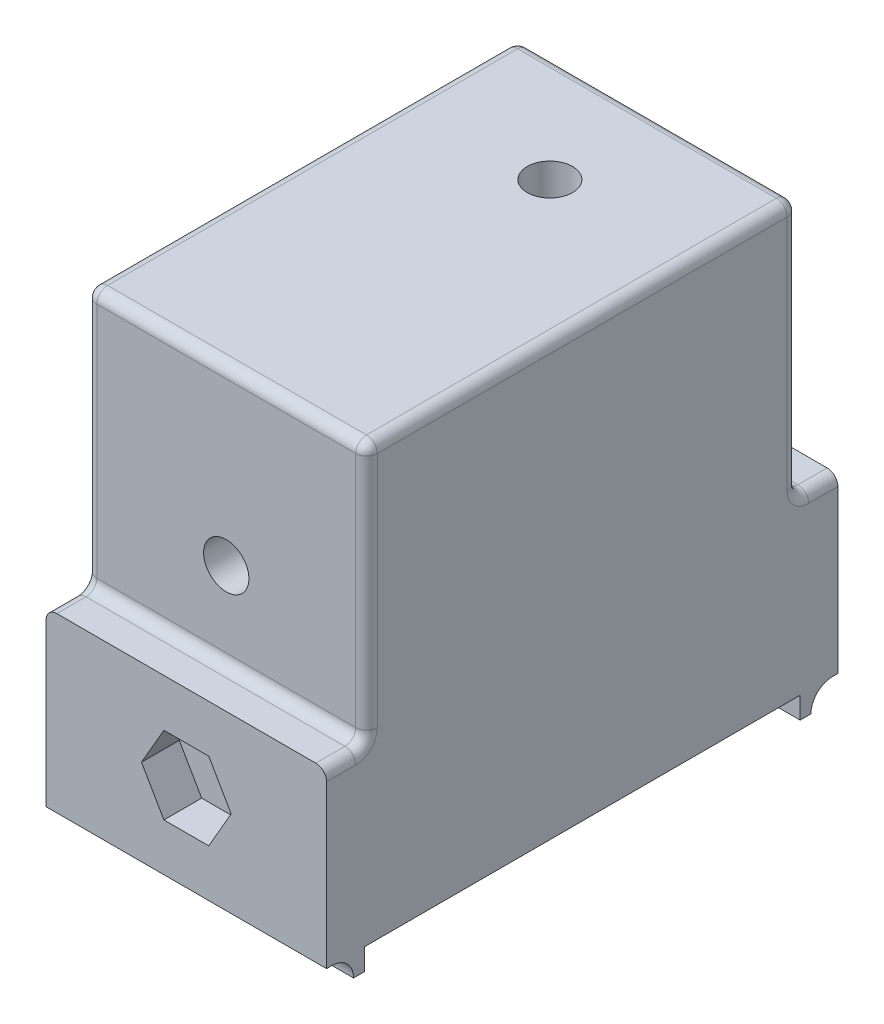
from build123d import *

# Parameters (mm, degrees)
SKETCH1_W           = 26
SKETCH1_H           = 40
BOSS_EXTRUDE1_DEPTH = 40
SKETCH2_W           = 26
SKETCH2_H           = 3.7
BOSS_EXTRUDE2_DEPTH = 16
SKETCH5_W           = 20
SKETCH5_H           = 34
CUT_EXTRUDE3_DEPTH  = 37
FILLET1_R           = 1
FILLET2_R           = 1
CUT_EXTRUDE6_DEPTH  = 3.5
SKETCH9_W           = 26
SKETCH9_H           = 1
BOSS_EXTRUDE3_DEPTH = 2
CUT_EXTRUDE7_REACH  = 62.652
SKETCH12_R          = 2.1
CUT_EXTRUDE8_REACH  = 51.947
SKETCH13_R          = 2.1
FILLET3_R           = 2


with BuildPart() as part:
    # Sketch1 → Boss-Extrude1 (new body)
    with BuildSketch(Plane(origin=(0, 0, 0), x_dir=(1, 0, 0), z_dir=(0, 1, 0))):
        Rectangle(SKETCH1_W, SKETCH1_H)
    extrude(amount=BOSS_EXTRUDE1_DEPTH)

    # Sketch2 → Boss-Extrude2 (add)
    with BuildSketch(Plane.XZ):
        with Locations((0, 21.85)):
            Rectangle(SKETCH2_W, SKETCH2_H)
        with Locations((0, -21.85)):
            Rectangle(SKETCH2_W, SKETCH2_H)
    extrude(amount=-BOSS_EXTRUDE2_DEPTH)

    # Sketch5 → Cut-Extrude3 (cut)
    with BuildSketch(Plane.XZ):
        Rectangle(SKETCH5_W, SKETCH5_H)
    extrude(amount=-CUT_EXTRUDE3_DEPTH, mode=Mode.SUBTRACT)

    # Fillet1
    fillet1_edges = [part.edges().sort_by_distance(p)[0] for p in [
        (13, 40, 0),
        (0, 40, -20),
        (-13, 16, 21.85),
        (13, 16, 21.85),
        (0, 16, 20),
        (-13, 16, -21.85),
        (0, 16, -20),
        (13, 16, -21.85),
        (-13, 40, 0),
        (0, 40, 20),
        (-13, 28, -20),
        (13, 28, -20),
        (13, 28, 20),
        (-13, 28, 20),
    ]]
    fillet(fillet1_edges, radius=FILLET1_R)

    # Fillet2
    fillet2_edges = [part.edges().sort_by_distance(p)[0] for p in [
        (-10, 37, 0),
        (-10, 18.5, -17),
        (0, 37, 17),
        (-10, 18.5, 17),
        (10, 37, 0),
        (10, 18.5, 17),
        (0, 37, -17),
        (10, 18.5, -17),
    ]]
    fillet(fillet2_edges, radius=FILLET2_R)

    # Sketch3 → Cut-Extrude6 (cut)
    with BuildSketch(Plane(origin=(0, 0, -23.7), x_dir=(-1, 0, 0), z_dir=(0, 0, -1))):
        Polygon((2.078460969, 11.6), (-2.078460969, 11.6), (-4.156921938, 8), (-2.078460969, 4.4), (2.078460969, 4.4), (4.156921938, 8), align=None)
    cut_extrude6 = extrude(amount=-CUT_EXTRUDE6_DEPTH, mode=Mode.SUBTRACT)

    # Mirror2: Cut-Extrude6 across plane
    add(cut_extrude6.mirror(Plane.XY), mode=Mode.SUBTRACT)

    # Sketch9 → Boss-Extrude3 (add)
    with BuildSketch(Plane.XZ):
        with Locations((0, 20.7)):
            Rectangle(SKETCH9_W, SKETCH9_H)
        with Locations((0, -20.7)):
            Rectangle(SKETCH9_W, SKETCH9_H)
    extrude(amount=BOSS_EXTRUDE3_DEPTH)

    # Sketch12 → Cut-Extrude7 (cut, up to next)
    with BuildSketch(Plane.XY.offset(20), mode=Mode.PRIVATE) as cut_extrude7_sk1:
        with Locations((0, 24)):
            Circle(SKETCH12_R)
    cut_extrude7_tool1 = extrude(cut_extrude7_sk1.sketch, amount=-CUT_EXTRUDE7_REACH, mode=Mode.PRIVATE) & part.part
    add(cut_extrude7_tool1.solids().sort_by_distance((0, 24, 20))[0], mode=Mode.SUBTRACT)

    # Sketch13 → Cut-Extrude8 (cut, up to next)
    with BuildSketch(Plane(origin=(0, 40, 0), x_dir=(1, 0, 0), z_dir=(0, 1, 0)), mode=Mode.PRIVATE) as cut_extrude8_sk1:
        with Locations(Location((0, 10, 0), (0, 0, 270))):
            Circle(SKETCH13_R)
    cut_extrude8_tool1 = extrude(cut_extrude8_sk1.sketch, amount=-CUT_EXTRUDE8_REACH, mode=Mode.PRIVATE) & part.part
    add(cut_extrude8_tool1.solids().sort_by_distance((0, 40, -10))[0], mode=Mode.SUBTRACT)

    # Fillet3
    fillet3_edges = [part.edges().sort_by_distance(p)[0] for p in [
        (0, 0, 21.2),
        (0, 0, -21.2),
    ]]
    fillet(fillet3_edges, radius=FILLET3_R - 0.0001)  # a hair under: the kernel refuses the full size


solid = part.part
